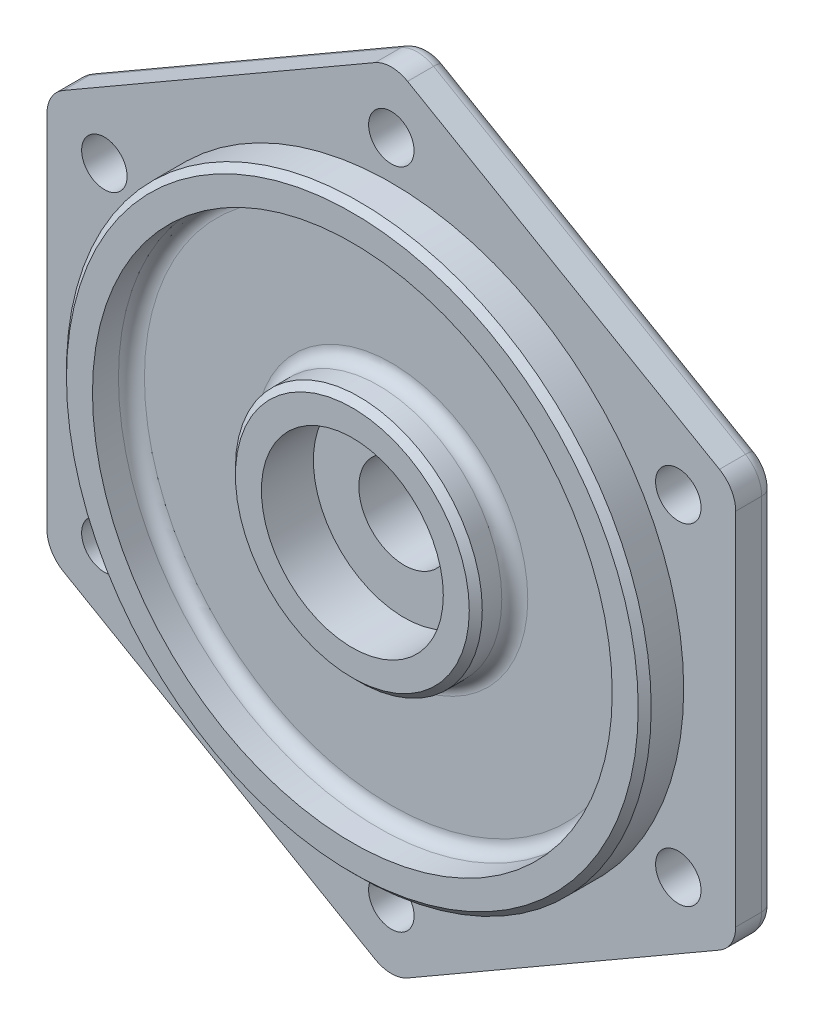
from build123d import *

# Parameters (mm, degrees)
BOSS_EXTRUDE1_DEPTH     = 6
SKETCH2_R               = 23
BOSS_EXTRUDE2_DEPTH     = 4
SKETCH4_R               = 45
BOSS_EXTRUDE3_DEPTH     = 6
SKETCH5_R               = 40
CUT_EXTRUDE1_DEPTH      = 6
SKETCH6_R               = 19
BOSS_EXTRUDE4_DEPTH     = 6
SKETCH7_R               = 14
CUT_EXTRUDE2_DEPTH      = 8
SKETCH8_R               = 7
CUT_EXTRUDE3_DEPTH      = 83.524743764
CUT_EXTRUDE4_DEPTH      = 82.574097196
CUT_EXTRUDE4_DEPTH_BACK = 82.574097196
SKETCH9_R               = 3.5
FILLET1_R               = 5
FILLET2_R               = 4
FILLET3_R               = 2
CHAMFER1_SIZE           = 1


with BuildPart() as part:
    # Sketch1 → Boss-Extrude1 (new body)
    with BuildSketch(Plane.XY):
        Polygon((0, 61.199128534), (-53, 30.599564267), (-53, -30.599564267), (0, -61.199128534), (53, -30.599564267), (53, 30.599564267), align=None)
    extrude(amount=-BOSS_EXTRUDE1_DEPTH)

    # Sketch2 → Boss-Extrude2 (add)
    with BuildSketch(Plane(origin=(0, 0, -6), x_dir=(-1, 0, 0), z_dir=(0, 0, -1))):
        Circle(SKETCH2_R)
    extrude(amount=BOSS_EXTRUDE2_DEPTH)

    # Sketch4 → Boss-Extrude3 (add)
    with BuildSketch(Plane.XY):
        Circle(SKETCH4_R)
    extrude(amount=BOSS_EXTRUDE3_DEPTH)

    # Sketch5 → Cut-Extrude1 (cut)
    with BuildSketch(Plane.XY.offset(6)):
        Circle(SKETCH5_R)
    extrude(amount=-CUT_EXTRUDE1_DEPTH, mode=Mode.SUBTRACT)

    # Sketch6 → Boss-Extrude4 (add)
    with BuildSketch(Plane.XY):
        Circle(SKETCH6_R)
    extrude(amount=BOSS_EXTRUDE4_DEPTH)

    # Sketch7 → Cut-Extrude2 (cut)
    with BuildSketch(Plane.XY.offset(6)):
        Circle(SKETCH7_R)
    extrude(amount=-CUT_EXTRUDE2_DEPTH, mode=Mode.SUBTRACT)

    # Sketch8 → Cut-Extrude3 (cut, through all)
    with BuildSketch(Plane(origin=(0, 0, -10), x_dir=(-1, 0, 0), z_dir=(0, 0, -1))):
        Circle(SKETCH8_R)
    extrude(amount=-CUT_EXTRUDE3_DEPTH, mode=Mode.SUBTRACT)

    # Sketch9 → Cut-Extrude4 (cut, two sides: drawn at the far end of the back side and taken through both)
    with BuildSketch(Plane.XY.offset(-CUT_EXTRUDE4_DEPTH_BACK)):
        with Locations((0, 51)):
            Circle(SKETCH9_R)
        with Locations((44.167295593, 25.5)):
            Circle(SKETCH9_R)
        with Locations((44.167295593, -25.5)):
            Circle(SKETCH9_R)
        with Locations((0, -51)):
            Circle(SKETCH9_R)
        with Locations((-44.167295593, -25.5)):
            Circle(SKETCH9_R)
        with Locations((-44.167295593, 25.5)):
            Circle(SKETCH9_R)
    extrude(amount=CUT_EXTRUDE4_DEPTH + CUT_EXTRUDE4_DEPTH_BACK, mode=Mode.SUBTRACT)

    # Fillet1
    fillet1_edges = [part.edges().sort_by_distance(p)[0] for p in [
        (53, 30.599564267, -3),
        (53, -30.599564267, -3),
        (0, -61.199128534, -3),
        (-53, -30.599564267, -3),
        (-53, 30.599564267, -3),
        (0, 61.199128534, -3),
    ]]
    fillet(fillet1_edges, radius=FILLET1_R)

    # Fillet2
    fillet2_edges = [part.edges().sort_by_distance(p)[0] for p in [
        (23, 0, -6),
    ]]
    fillet(fillet2_edges, radius=FILLET2_R - 0.0001)  # a hair under: the kernel refuses the full size

    # Fillet3
    fillet3_edges = [part.edges().sort_by_distance(p)[0] for p in [
        (-40, 0, 0),
        (-19, 0, 0),
        (26.5, 45.899346401, -6),
        (-26.5, 45.899346401, -6),
        (53, 0, -6),
        (26.5, -45.899346401, -6),
        (-26.5, -45.899346401, -6),
        (-53, 0, -6),
        (-52.330127019, 30.212812921, -6),
        (52.330127019, 30.212812921, -6),
        (52.330127019, -30.212812921, -6),
        (0, -60.425625842, -6),
        (-52.330127019, -30.212812921, -6),
        (0, 60.425625842, -6),
    ]]
    fillet(fillet3_edges, radius=FILLET3_R)

    # Chamfer1
    chamfer1_edges = [part.edges().sort_by_distance(p)[0] for p in [
        (-45, 0, 6),
        (-19, 0, 6),
    ]]
    chamfer(chamfer1_edges, length=CHAMFER1_SIZE)


solid = part.part
